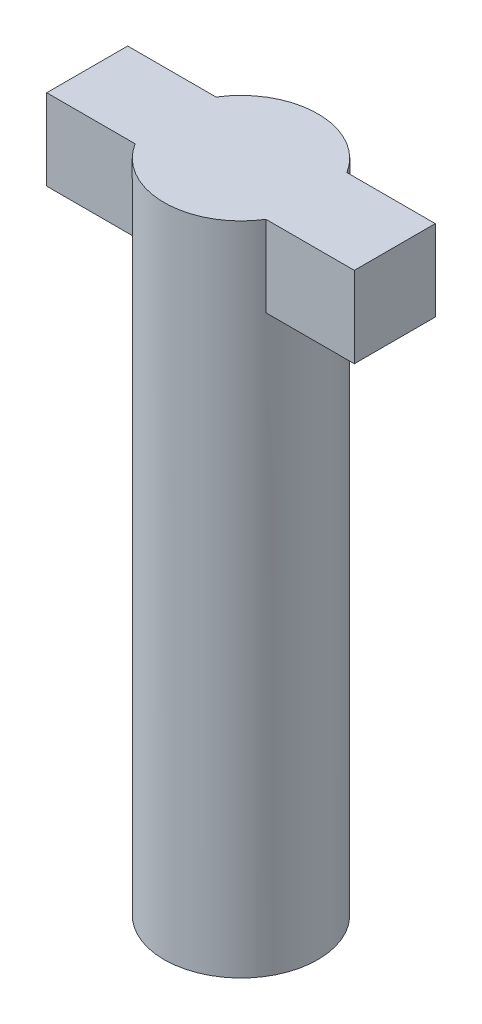
from build123d import *

# Parameters (mm, degrees)
SKETCH1_R  = 0.95
BODY_DEPTH = 8.1
LOCK_START = -1
LOCK_DEPTH = 1


with BuildPart() as part:
    # Sketch1 → Body (new body)
    with BuildSketch(Plane(origin=(0, 0, 0), x_dir=(1, 0, 0), z_dir=(0, 1, 0))):
        Circle(SKETCH1_R)
    extrude(amount=BODY_DEPTH)

    # Sketch2 → Lock (add)
    with BuildSketch(Plane(origin=(0, 8.1, 0), x_dir=(1, 0, 0), z_dir=(0, 1, 0)).offset(LOCK_START)):
        with BuildLine():
            ThreePointArc((-0.807774721, -0.5), (-0.95, 0), (-0.807774721, 0.5))
            Line((-0.807774721, 0.5), (-1.9, 0.5))
            Line((-1.9, 0.5), (-1.9, -0.5))
            Line((-1.9, -0.5), (-0.807774721, -0.5))
        make_face()
        with BuildLine():
            Line((1.9, 0.5), (0.807774721, 0.5))
            ThreePointArc((0.807774721, 0.5), (0.95, 0), (0.807774721, -0.5))
            Line((0.807774721, -0.5), (1.9, -0.5))
            Line((1.9, -0.5), (1.9, 0.5))
        make_face()
    extrude(amount=LOCK_DEPTH)


solid = part.part
